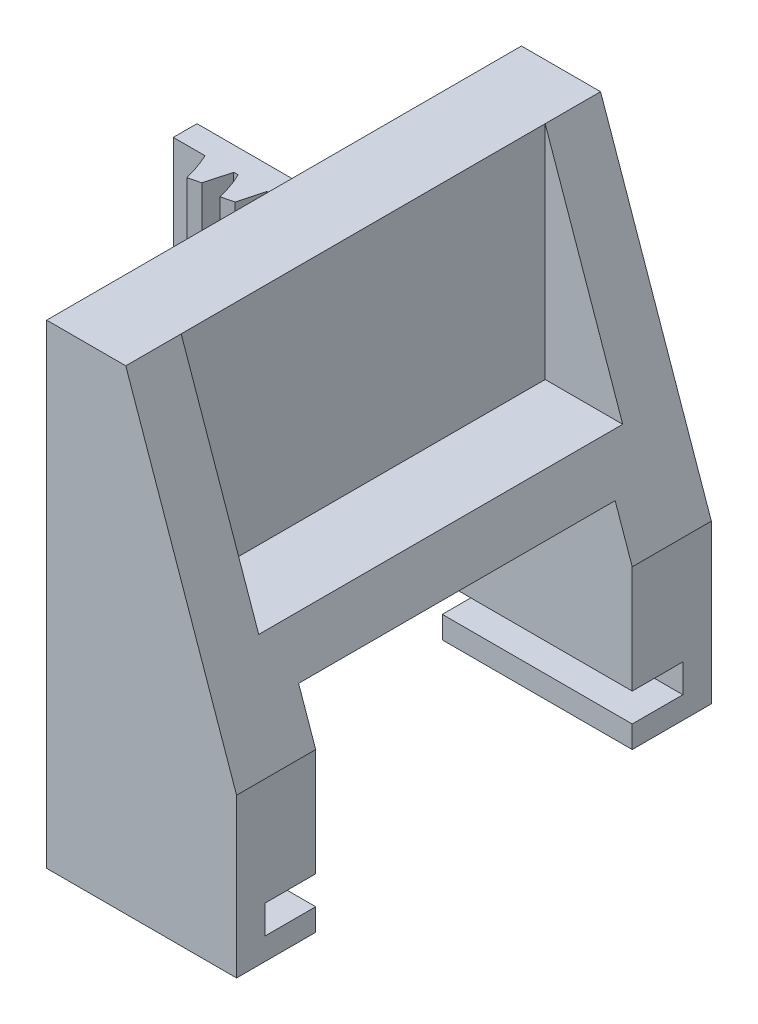
from build123d import *

# Parameters (mm, degrees)
BOSS_EXTRUDE1_DEPTH = 30
SKETCH4_W           = 20
SKETCH4_H           = 14
CUT_EXTRUDE2_DEPTH  = 25
SKETCH5_W           = 3.2
SKETCH5_H           = 1.8
CUT_EXTRUDE3_DEPTH  = 15
CUT_EXTRUDE4_DEPTH  = 11.5
BOSS_EXTRUDE2_DEPTH = 8


with BuildPart() as part:
    # Sketch1 → Boss-Extrude1 (new body)
    with BuildSketch(Plane.XY):
        Polygon((0, 0), (0, -30), (12, -30), (12, -20), (5, 0), align=None)
    extrude(amount=-BOSS_EXTRUDE1_DEPTH)

    # Sketch4 → Cut-Extrude2 (cut)
    with BuildSketch(Plane.ZY):
        with Locations((-15, -23.917856259)):
            Rectangle(SKETCH4_W, SKETCH4_H)
    extrude(amount=-CUT_EXTRUDE2_DEPTH, mode=Mode.SUBTRACT)

    # Sketch5 → Cut-Extrude3 (cut)
    with BuildSketch(Plane.ZY):
        with Locations((-3.4, -27.7)):
            Rectangle(SKETCH5_W, SKETCH5_H)
    cut_extrude3 = extrude(amount=-CUT_EXTRUDE3_DEPTH, mode=Mode.SUBTRACT)

    # Mirror1: Cut-Extrude3 across plane
    add(cut_extrude3.mirror(Plane.XY.offset(-15)), mode=Mode.SUBTRACT)

    # Sketch6 → Cut-Extrude4 (cut, symmetric)
    with BuildSketch(Plane.XY.offset(-15)):
        Polygon((5, 0), (5, -14), (9.9, -14), align=None)
    extrude(amount=CUT_EXTRUDE4_DEPTH, both=True, mode=Mode.SUBTRACT)

    # Sketch7 → Boss-Extrude2 (add)
    with BuildSketch(Plane(origin=(0, -21, 0), x_dir=(1, 0, 0), z_dir=(0, 1, 0))):
        with BuildLine():
            Line((0, 28.5), (-19, 28.5))
            Line((-19, 28.5), (-19, 27))
            Line((-19, 27), (-16.993455994, 27))
            ThreePointArc((-16.993455994, 27), (-16.636279679, 26.129093684), (-16.365476207, 25.227584833))
            Line((-16.365476207, 25.227584833), (-15.609396851, 25.415112691))
            Line((-15.609396851, 25.415112691), (-15.179008189, 27))
            Line((-15.179008189, 27), (-14.896454824, 27))
            ThreePointArc((-14.896454824, 27), (-14.539278509, 26.129093684), (-14.268475038, 25.227584833))
            Line((-14.268475038, 25.227584833), (-13.512395681, 25.415112691))
            Line((-13.512395681, 25.415112691), (-13.082007019, 27))
            Line((-13.082007019, 27), (-12.799453654, 27))
            ThreePointArc((-12.799453654, 27), (-12.442277339, 26.129093684), (-12.171473868, 25.227584833))
            Line((-12.171473868, 25.227584833), (-11.415394512, 25.415112691))
            Line((-11.415394512, 25.415112691), (-10.985005849, 27))
            Line((-10.985005849, 27), (-10.702452484, 27))
            ThreePointArc((-10.702452484, 27), (-10.34527617, 26.129093684), (-10.074472698, 25.227584833))
            Line((-10.074472698, 25.227584833), (-9.318393342, 25.415112691))
            Line((-9.318393342, 25.415112691), (-8.888004679, 27))
            Line((-8.888004679, 27), (-8.605451315, 27))
            ThreePointArc((-8.605451315, 27), (-8.248275, 26.129093684), (-7.977471528, 25.227584833))
            Line((-7.977471528, 25.227584833), (-7.221392172, 25.415112691))
            Line((-7.221392172, 25.415112691), (-6.791003509, 27))
            Line((-6.791003509, 27), (-6.508450145, 27))
            ThreePointArc((-6.508450145, 27), (-6.15127383, 26.129093684), (-5.880470358, 25.227584833))
            Line((-5.880470358, 25.227584833), (-5.124391002, 25.415112691))
            Line((-5.124391002, 25.415112691), (-4.69400234, 27))
            Line((-4.69400234, 27), (-4.411448975, 27))
            ThreePointArc((-4.411448975, 27), (-4.05427266, 26.129093684), (-3.783469189, 25.227584833))
            Line((-3.783469189, 25.227584833), (-3.027389832, 25.415112691))
            Line((-3.027389832, 25.415112691), (-2.59700117, 27))
            Line((-2.59700117, 27), (-2.314447805, 27))
            ThreePointArc((-2.314447805, 27), (-1.95727149, 26.129093684), (-1.686468019, 25.227584833))
            Line((-1.686468019, 25.227584833), (-0.930388662, 25.415112691))
            Line((-0.930388662, 25.415112691), (-0.5, 27))
            Line((-0.5, 27), (0, 27))
            Line((0, 27), (0, 28.5))
        make_face()
    extrude(amount=BOSS_EXTRUDE2_DEPTH)


solid = part.part
